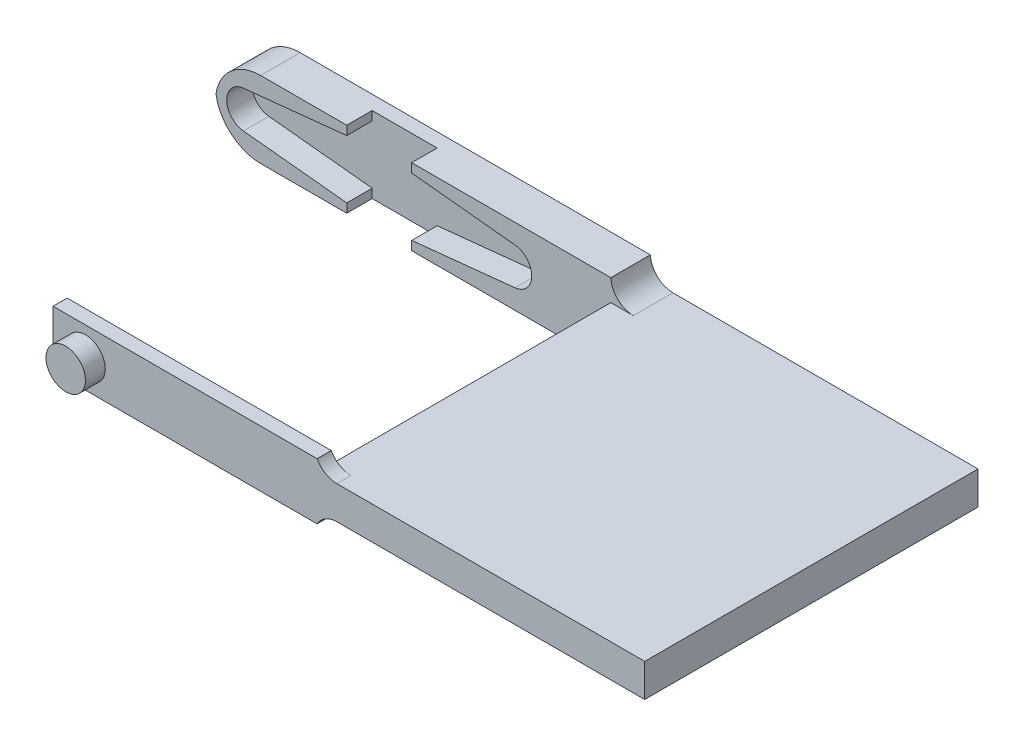
from build123d import *

# Parameters (mm, degrees)
SKETCH1_W            = 35
SKETCH1_H            = 6.75
BOSS_EXTRUDE10_DEPTH = 3.5
SKETCH1_16_R         = 0.291434634
BOSS_EXTRUDE15_DEPTH = 1.25
SKETCH1_17_W         = 29
SKETCH1_17_H         = 2.924143722
BOSS_EXTRUDE17_DEPTH = 29.5
BOSS_EXTRUDE18_DEPTH = 1.25
SKETCH2_9_R          = 1.75
BOSS_EXTRUDE19_DEPTH = 1.75
FILLET1_R            = 2
FILLET2_R            = 4
SKETCH3_W            = 5.75
SKETCH3_H            = 0.795101344
CUT_EXTRUDE1_DEPTH   = 2.25


with BuildPart() as part:
    # Sketch1 → Boss-Extrude10 (new body)
    with BuildSketch(Plane.XY):
        with Locations((3, 3.375)):
            Rectangle(SKETCH1_W, SKETCH1_H)
        with BuildLine():
            Line((0, 6.25), (12.018477316, 5.016376067))
            ThreePointArc((12.018477316, 5.016376067), (13.5, 3.375), (12.018477316, 1.733623933))
            Line((12.018477316, 1.733623933), (0, 0.5))
            Line((0, 0.5), (-12.018477316, 1.733623933))
            ThreePointArc((-12.018477316, 1.733623933), (-13.5, 3.375), (-12.018477316, 5.016376067))
            Line((-12.018477316, 5.016376067), (0, 6.25))
        make_face(mode=Mode.SUBTRACT)
    extrude(amount=BOSS_EXTRUDE10_DEPTH)

    # Sketch1<16> → Boss-Extrude15 (add)
    # profile 1 of 9: a face of its own
    with BuildSketch(Plane.XY):
        with BuildLine():
            Line((-0.584049273, 6.190050878), (-12.018477316, 5.016376067))
            ThreePointArc((-12.018477316, 5.016376067), (-13.5, 3.375), (-12.018477316, 1.733623933))
            Line((-12.018477316, 1.733623933), (-0.584049273, 0.559949122))
            ThreePointArc((-0.584049273, 0.559949122), (-2.875, 3.375), (-0.584049273, 6.190050878))
        make_face()
        with Locations((-11.85, 3.375)):
            Circle(SKETCH1_16_R, mode=Mode.SUBTRACT)
        with Locations((-9.813185408, 3.375)):
            Circle(SKETCH1_16_R, mode=Mode.SUBTRACT)
        with Locations((-7.776370816, 3.375)):
            Circle(SKETCH1_16_R, mode=Mode.SUBTRACT)
    # profile 2 of 9: a face of its own
    with BuildSketch(Plane.XY):
        with Locations((-11.85, 3.375)):
            Circle(SKETCH1_16_R)
    # profile 3 of 9: a face of its own
    with BuildSketch(Plane.XY):
        with Locations((-7.776370816, 3.375)):
            Circle(SKETCH1_16_R)
    # profile 4 of 9: a face of its own
    with BuildSketch(Plane.XY):
        with Locations((-9.813185408, 3.375)):
            Circle(SKETCH1_16_R)
    # profile 5 of 9: a face of its own
    with BuildSketch(Plane.XY):
        with BuildLine():
            Line((0, 6.25), (-0.584049273, 6.190050878))
            ThreePointArc((-0.584049273, 6.190050878), (-2.875, 3.375), (-0.584049273, 0.559949122))
            Line((-0.584049273, 0.559949122), (0, 0.5))
            Line((0, 0.5), (0.584049273, 0.559949122))
            ThreePointArc((0.584049273, 0.559949122), (2.229884152, 1.56027091), (2.875, 3.375))
            ThreePointArc((2.875, 3.375), (2.229884152, 5.18972909), (0.584049273, 6.190050878))
            Line((0.584049273, 6.190050878), (0, 6.25))
        make_face()
    # profile 6 of 9: a face of its own
    with BuildSketch(Plane.XY):
        with BuildLine():
            Line((12.018477316, 5.016376067), (0.584049273, 6.190050878))
            ThreePointArc((0.584049273, 6.190050878), (2.229884152, 5.18972909), (2.875, 3.375))
            ThreePointArc((2.875, 3.375), (2.229884152, 1.56027091), (0.584049273, 0.559949122))
            Line((0.584049273, 0.559949122), (12.018477316, 1.733623933))
            ThreePointArc((12.018477316, 1.733623933), (13.5, 3.375), (12.018477316, 5.016376067))
        make_face()
        with Locations((7.776370816, 3.375)):
            Circle(SKETCH1_16_R, mode=Mode.SUBTRACT)
        with Locations((9.813185408, 3.375)):
            Circle(SKETCH1_16_R, mode=Mode.SUBTRACT)
        with Locations((11.85, 3.375)):
            Circle(SKETCH1_16_R, mode=Mode.SUBTRACT)
    # profile 7 of 9: a face of its own
    with BuildSketch(Plane.XY):
        with Locations((11.85, 3.375)):
            Circle(SKETCH1_16_R)
    # profile 8 of 9: a face of its own
    with BuildSketch(Plane.XY):
        with Locations((9.813185408, 3.375)):
            Circle(SKETCH1_16_R)
    # profile 9 of 9: a face of its own
    with BuildSketch(Plane.XY):
        with Locations((7.776370816, 3.375)):
            Circle(SKETCH1_16_R)
    extrude(amount=BOSS_EXTRUDE15_DEPTH)

    # Sketch1<17> → Boss-Extrude17 (add)
    with BuildSketch(Plane.XY):
        with Locations((35, 3.375)):
            Rectangle(SKETCH1_17_W, SKETCH1_17_H)
    extrude(amount=BOSS_EXTRUDE17_DEPTH)

    # Sketch2 → Boss-Extrude18 (add)
    with BuildSketch(Plane.XY.offset(29.5)):
        Polygon((14.5, 5.875), (-2.875, 5.875), (-2.875, 0.875), (14.5, 0.875), (20.5, 0.875), (20.5, 5.875), align=None)
    extrude(amount=-BOSS_EXTRUDE18_DEPTH)

    # Sketch2<9> → Boss-Extrude19 (add)
    with BuildSketch(Plane.XY.offset(29.5)):
        with Locations((0, 3.375)):
            Circle(SKETCH2_9_R)
    extrude(amount=BOSS_EXTRUDE19_DEPTH)

    # Fillet1
    # the kernel refuses this fillet: 2 mm, written as the material it adds along each edge
    with BuildSketch(Plane(origin=(20.5, 1.912928139, 0), x_dir=(0, -1, 0), z_dir=(0, 0, 1))) as fillet1_piece_1:
        with BuildLine():
            CenterArc((2, 1.998103724), FILLET1_R, 180, 87.504786267)
            Line((0, 1.998103724), (0, 0))
            Line((0, 0), (1.912928139, 0))
        make_face()
    extrude(amount=3.5)
    with BuildSketch(Plane(origin=(20.5, 4.837071861, 0), x_dir=(0, 1, 0), z_dir=(0, 0, 1))) as fillet1_piece_2:
        with BuildLine():
            CenterArc((2, -1.998103724), FILLET1_R, 92.495213733, 87.504786267)
            Line((0, -1.998103724), (0, 0))
            Line((0, 0), (1.912928139, 0))
        make_face()
    extrude(amount=3.5)
    with BuildSketch(Plane(origin=(20.5, 1.912928139, 28.25), x_dir=(1, 0, 0), z_dir=(0, 0, 1))) as fillet1_piece_3:
        with BuildLine():
            CenterArc((1.753401761, -2), FILLET1_R, 90, 61.246917848)
            Line((0, -1.037928139), (0, 0))
            Line((0, 0), (1.753401761, 0))
        make_face()
    extrude(amount=1.25)
    with BuildSketch(Plane(origin=(20.5, 4.837071861, 28.25), x_dir=(1, 0, 0), z_dir=(0, 0, 1))) as fillet1_piece_4:
        with BuildLine():
            CenterArc((1.753401761, 2), FILLET1_R, 208.753082152, 61.246917848)
            Line((0, 1.037928139), (0, 0))
            Line((0, 0), (1.753401761, 0))
        make_face()
    extrude(amount=1.25)

    # Fillet2
    # the kernel refuses this fillet: 4 mm, written as the material it takes off along each edge
    with BuildSketch(Plane(origin=(-14.5, 6.75, -10), x_dir=(0, -1, 0), z_dir=(0, 0, 1)), Plane(origin=(-14.5, 0, -10), x_dir=(1, 0, 0), z_dir=(0, 0, 1))) as fillet2_piece_1:
        with BuildLine():
            CenterArc((FILLET2_R, FILLET2_R), FILLET2_R, 180, 90)
            Line((0, FILLET2_R), (0, 0))
            Line((0, 0), (FILLET2_R, 0))
        make_face()
    extrude(amount=23.5, mode=Mode.SUBTRACT)

    # Sketch3 → Cut-Extrude1 (cut)
    with BuildSketch(Plane.XY.offset(3.5)):
        with Locations((0, 0.397550672)):
            Rectangle(SKETCH3_W, SKETCH3_H)
        with Locations((0, 6.352449328)):
            Rectangle(SKETCH3_W, SKETCH3_H)
    extrude(amount=-CUT_EXTRUDE1_DEPTH, mode=Mode.SUBTRACT)


solid = part.part
